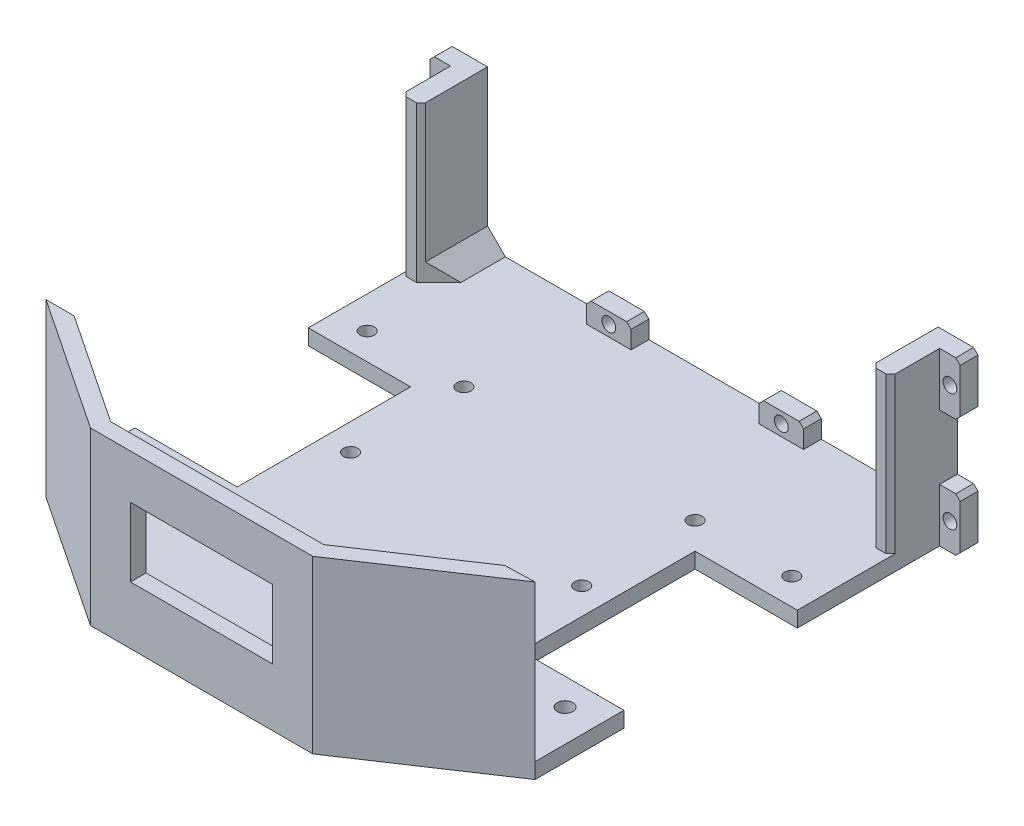
from build123d import *

# Parameters (mm, degrees)
BOSS_EXTRUDE1_DEPTH  = 3.5
BOSS_EXTRUDE2_DEPTH  = 21
SKETCH3_W            = 23
SKETCH3_H            = 39
BOSS_EXTRUDE3_DEPTH  = 2.5
SKETCH5_W            = 21.5
SKETCH5_H            = 25
SKETCH5_W_2          = 7.07
SKETCH5_H_2          = 19.04
BOSS_EXTRUDE5_DEPTH  = 2.5
SKETCH6_W            = 7.07
SKETCH6_H            = 5.9
BOSS_EXTRUDE6_DEPTH  = 20
BOSS_EXTRUDE7_DEPTH  = 23
FILLET1_SIZE         = 10
SKETCH9_R            = 2.475
BOSS_EXTRUDE8_DEPTH  = 9
FILLET2_R            = 0.5
SKETCH10_R           = 1.65
CUT_EXTRUDE1_DEPTH   = 9
SKETCH11_W           = 0.2
SKETCH11_H           = 20
CUT_EXTRUDE2_DEPTH   = 9
CUT_EXTRUDE3_DEPTH   = 9
FILLET3_SIZE         = 3
BOSS_EXTRUDE9_DEPTH  = 5
SKETCH14_R           = 1.747814763
SKETCH14_R_2         = 1.6
CUT_EXTRUDE4_DEPTH   = 15
BOSS_EXTRUDE10_DEPTH = 35
SKETCH17_W           = 110
SKETCH17_H           = 3.5
BOSS_EXTRUDE11_DEPTH = 15
SKETCH18_W           = 161.485932181
SKETCH18_H           = 44
CUT_EXTRUDE5_DEPTH   = 63
SKETCH19_W           = 4.328620931
SKETCH19_H           = 15
BOSS_EXTRUDE12_DEPTH = 35
FILLET4_SIZE         = 1
SKETCH20_W           = 4.640065176
SKETCH20_H           = 12
SKETCH20_R           = 1.55
SKETCH20_W_2         = 10
SKETCH20_H_2         = 5
BOSS_EXTRUDE13_DEPTH = 4
SKETCH21_W           = 32
SKETCH21_H           = 15.5
CUT_EXTRUDE6_DEPTH   = 14
FILLET5_SIZE         = 1
FILLET6_SIZE         = 4


with BuildPart() as part:
    # Sketch1 → Boss-Extrude1 (new body)
    with BuildSketch(Plane(origin=(0, 0, 0), x_dir=(1, 0, 0), z_dir=(0, 1, 0))):
        Polygon((0, 40), (23, 40), (23, 79), (0, 79), (0, 100), (110, 100), (110, 79), (87, 79), (87, 40), (110, 40), (110, 20), (80, 0), (30, 0), (0, 20), align=None)
    extrude(amount=BOSS_EXTRUDE1_DEPTH)

    # Sketch2 → Boss-Extrude2 (add)
    with BuildSketch(Plane(origin=(0, 3.5, 0), x_dir=(1, 0, 0), z_dir=(0, 1, 0))):
        Polygon((0, 79), (23, 79), (23, 40), (0, 40), (0, 37.5), (25.5, 37.5), (25.5, 81.5), (0, 81.5), align=None)
        Polygon((110, 81.5), (84.5, 81.5), (84.5, 37.5), (110, 37.5), (110, 40), (87, 40), (87, 79), (110, 79), align=None)
    extrude(amount=BOSS_EXTRUDE2_DEPTH)

    # Sketch3 → Boss-Extrude3 (add)
    with BuildSketch(Plane(origin=(0, 24.5, 0), x_dir=(1, 0, 0), z_dir=(0, 1, 0))):
        with Locations((11.5, 59.5)):
            Rectangle(SKETCH3_W, SKETCH3_H)
        with Locations((98.5, 59.5)):
            Rectangle(SKETCH3_W, SKETCH3_H)
    extrude(amount=-BOSS_EXTRUDE3_DEPTH)

    # Sketch5 → Boss-Extrude5 (add)
    with BuildSketch(Plane(origin=(0, 24.5, 0), x_dir=(1, 0, 0), z_dir=(0, 1, 0))):
        with Locations((120.75, 50)):
            Rectangle(SKETCH5_W, SKETCH5_H)
        with Locations((-10.75, 50)):
            Rectangle(SKETCH5_W, SKETCH5_H)
        with Locations((29.035, 47.02)):
            Rectangle(SKETCH5_W_2, SKETCH5_H_2)
        with Locations((80.965, 47.02)):
            Rectangle(SKETCH5_W_2, SKETCH5_H_2)
    extrude(amount=-BOSS_EXTRUDE5_DEPTH)

    # Sketch6 → Boss-Extrude6 (add)
    with BuildSketch(Plane(origin=(0, 24.5, 0), x_dir=(1, 0, 0), z_dir=(0, 1, 0))):
        with Locations((29.035, 53.59)):
            Rectangle(SKETCH6_W, SKETCH6_H)
        with Locations((80.965, 53.59)):
            Rectangle(SKETCH6_W, SKETCH6_H)
        with Locations((-17.965, 53.59)):
            Rectangle(SKETCH6_W, SKETCH6_H)
        with Locations((127.965, 53.59)):
            Rectangle(SKETCH6_W, SKETCH6_H)
    extrude(amount=BOSS_EXTRUDE6_DEPTH)

    # Sketch7 → Boss-Extrude7 (add)
    with BuildSketch(Plane(origin=(0, 24.5, 0), x_dir=(1, 0, 0), z_dir=(0, 1, 0))):
        Polygon((0, 81.5), (25.5, 81.5), (25.5, 79), (0, 79), (-21.5, 79), (-21.5, 81.5), align=None)
        Polygon((110, 79), (84.5, 79), (84.5, 81.5), (110, 81.5), (131.5, 81.5), (131.5, 79), align=None)
    extrude(amount=BOSS_EXTRUDE7_DEPTH)

    # Fillet1
    # the kernel refuses this chamfer: 10 mm, written as the material it adds along each edge
    with BuildSketch(Plane(origin=(0, 22, -40), x_dir=(0.027495876610586372, -0.9996219169112968, 0), z_dir=(0, 0, 1)), Plane(origin=(110, 22, -37.5), x_dir=(-0.027495876610586317, -0.9996219169112968, 0), z_dir=(0, 0, -1)), Plane(origin=(110, 24.5, -81.5), x_dir=(0.9996219169112968, 0.027495876610586317, 0), z_dir=(0, 0, 1))) as fillet1_piece_1:
        Polygon((FILLET1_SIZE * 0.999621916911, -FILLET1_SIZE * 0.0274958766106), (-FILLET1_SIZE * 0.0274958766106, -FILLET1_SIZE * 0.999621916911), (0, 0), align=None)
    extrude(amount=2.5)
    with BuildSketch(Plane(origin=(0, 24.5, -79), x_dir=(0.027495876610586372, -0.9996219169112968, 0), z_dir=(0, 0, -1))) as fillet1_piece_2:
        Polygon((FILLET1_SIZE * 0.999621916911, FILLET1_SIZE * 0.0274958766106), (-FILLET1_SIZE * 0.0274958766106, FILLET1_SIZE * 0.999621916911), (0, 0), align=None)
    extrude(amount=2.5)

    # Sketch9 → Boss-Extrude8 (add)
    with BuildSketch(Plane(origin=(0, 0, -81.5), x_dir=(-1, 0, 0), z_dir=(0, 0, -1))):
        with Locations(Location((-114.55, 34.35, 0), (0, 0, 180))):
            Circle(SKETCH9_R)
        with Locations(Location((4.55, 34.35, 0), (0, 0, 180))):
            Circle(SKETCH9_R)
    extrude(amount=BOSS_EXTRUDE8_DEPTH)

    # Fillet2
    fillet2_edges = [part.edges().sort_by_distance(p)[0] for p in [
        (112.075, 34.35, -90.5),
        (-7.025, 34.35, -90.5),
    ]]
    fillet(fillet2_edges, radius=FILLET2_R)

    # Sketch10 → Cut-Extrude1 (cut)
    with BuildSketch(Plane.XY.offset(-50.64)):
        with Locations((129.16, 39.27)):
            Circle(SKETCH10_R)
        with Locations((129.16, 29.43)):
            Circle(SKETCH10_R)
        with Locations((79.77, 39.27)):
            Circle(SKETCH10_R)
        with Locations((79.77, 29.43)):
            Circle(SKETCH10_R)
        with Locations((-19.16, 29.43)):
            Circle(SKETCH10_R)
        with Locations((-19.16, 39.27)):
            Circle(SKETCH10_R)
        with Locations(Location((30.23, 39.27, 0), (0, 0, 180))):
            Circle(SKETCH10_R)
        with Locations(Location((30.23, 29.43, 0), (0, 0, 180))):
            Circle(SKETCH10_R)
    extrude(amount=-CUT_EXTRUDE1_DEPTH, mode=Mode.SUBTRACT)

    # Sketch11 → Cut-Extrude2 (cut)
    with BuildSketch(Plane.XY.offset(-50.64)):
        with Locations((-14.53, 34.5)):
            Rectangle(SKETCH11_W, SKETCH11_H)
        with Locations((25.6, 34.5)):
            Rectangle(SKETCH11_W, SKETCH11_H)
        with Locations((84.4, 34.5)):
            Rectangle(SKETCH11_W, SKETCH11_H)
        with Locations((124.53, 34.5)):
            Rectangle(SKETCH11_W, SKETCH11_H)
    extrude(amount=-CUT_EXTRUDE2_DEPTH, mode=Mode.SUBTRACT)

    # Sketch12 → Cut-Extrude3 (cut)
    with BuildSketch(Plane(origin=(0, 0, -81.5), x_dir=(-1, 0, 0), z_dir=(0, 0, -1))):
        Polygon((-108, 47.5), (-84.5, 25.5), (-84.5, 47.5), align=None)
        Polygon((-25.5, 25.5), (-25.5, 47.5), (-2, 47.5), align=None)
        Polygon((-120, 24.5), (-131.5, 36), (-131.5, 24.5), align=None)
        Polygon((10, 24.5), (21.5, 36), (21.5, 24.5), align=None)
    extrude(amount=-CUT_EXTRUDE3_DEPTH, mode=Mode.SUBTRACT)

    # Fillet3
    fillet3_edges = [part.edges().sort_by_distance(p)[0] for p in [
        (0, 23.25, -62.5),
        (110, 23.25, -62.5),
    ]]
    chamfer(fillet3_edges, length=FILLET3_SIZE)

    # Sketch13 → Boss-Extrude9 (add)
    with BuildSketch(Plane(origin=(0, 3.5, 0), x_dir=(1, 0, 0), z_dir=(0, 1, 0))):
        Polygon((0, 30.5), (32.5, 30.5), (32.5, 88.5), (0, 88.5), (0, 81.5), (25.5, 81.5), (25.5, 37.5), (0, 37.5), align=None)
        Polygon((84.5, 37.5), (110, 37.5), (110, 30.5), (77.5, 30.5), (77.5, 88.5), (110, 88.5), (110, 81.5), (84.5, 81.5), align=None)
    extrude(amount=BOSS_EXTRUDE9_DEPTH)

    # Sketch14 → Cut-Extrude4 (cut)
    with BuildSketch(Plane(origin=(0, 8.5, 0), x_dir=(1, 0, 0), z_dir=(0, 1, 0))):
        with Locations(Location((7.25, 34, 0), (0, 0, 270))):
            Circle(SKETCH14_R)
        with Locations(Location((7.25, 85, 0), (0, 0, 270))):
            Circle(SKETCH14_R_2)
        with Locations(Location((29, 34, 0), (0, 0, 270))):
            Circle(SKETCH14_R_2)
        with Locations(Location((29, 59.5, 0), (0, 0, 270))):
            Circle(SKETCH14_R_2)
        with Locations(Location((29, 85, 0), (0, 0, 270))):
            Circle(SKETCH14_R_2)
        with Locations(Location((81, 34, 0), (0, 0, 90))):
            Circle(SKETCH14_R_2)
        with Locations(Location((102.75, 34, 0), (0, 0, 90))):
            Circle(SKETCH14_R)
        with Locations(Location((81, 59.5, 0), (0, 0, 90))):
            Circle(SKETCH14_R_2)
        with Locations(Location((81, 85, 0), (0, 0, 90))):
            Circle(SKETCH14_R_2)
        with Locations(Location((102.75, 85, 0), (0, 0, 90))):
            Circle(SKETCH14_R_2)
    extrude(amount=-CUT_EXTRUDE4_DEPTH, mode=Mode.SUBTRACT)

    # Sketch15 → Boss-Extrude10 (add)
    with BuildSketch(Plane(origin=(0, 3.5, 0), x_dir=(1, 0, 0), z_dir=(0, 1, 0))):
        Polygon((110, 20), (80, 0), (30, 0), (0, 20), (6.309714732, 20), (31.059714732, 3.5), (78.940285268, 3.5), (103.405491726, 19.81009599), align=None)
    extrude(amount=BOSS_EXTRUDE10_DEPTH)

    # Sketch17 → Boss-Extrude11 (add)
    with BuildSketch(Plane(origin=(0, 0, -100), x_dir=(-1, 0, 0), z_dir=(0, 0, -1))):
        with Locations((-55, 1.75)):
            Rectangle(SKETCH17_W, SKETCH17_H)
    extrude(amount=BOSS_EXTRUDE11_DEPTH)

    # Sketch18 → Cut-Extrude5 (cut)
    with BuildSketch(Plane(origin=(0, 0, -88.5), x_dir=(-1, 0, 0), z_dir=(0, 0, -1))):
        with Locations((-59.242966091, 25.5)):
            Rectangle(SKETCH18_W, SKETCH18_H)
    extrude(amount=-CUT_EXTRUDE5_DEPTH, mode=Mode.SUBTRACT)


with BuildPart() as body_2:
    # of the pieces the cut leaves, the one that is kept (cut_extrude5_keep)
    add(part.part.solids().sort_by_distance((0, 3.5, -79))[0])

    # Sketch19 → Boss-Extrude12 (add)
    with BuildSketch(Plane(origin=(0, 3.5, 0), x_dir=(1, 0, 0), z_dir=(0, 1, 0))):
        with Locations((107.835689535, 107.5)):
            Rectangle(SKETCH19_W, SKETCH19_H)
        with Locations((2.164310466, 107.5)):
            Rectangle(SKETCH19_W, SKETCH19_H)
    extrude(amount=BOSS_EXTRUDE12_DEPTH)

    # Fillet4
    fillet4_edges = [body_2.edges().sort_by_distance(p)[0] for p in [
        (0, 21, -100),
        (4.328620931, 21, -100),
        (110, 21, -100),
        (105.671379069, 21, -100),
    ]]
    chamfer(fillet4_edges, length=FILLET4_SIZE)

    # Sketch20 → Boss-Extrude13 (add)
    # profile 1 of 6: a face of its own
    with BuildSketch(Plane(origin=(0, 0, -115), x_dir=(-1, 0, 0), z_dir=(0, 0, -1))):
        with Locations((-112.320032588, 32.5)):
            Rectangle(SKETCH20_W, SKETCH20_H)
        with Locations((-112.320032588, 32.5)):
            Circle(SKETCH20_R, mode=Mode.SUBTRACT)
    # profile 2 of 6: a face of its own
    with BuildSketch(Plane(origin=(0, 0, -115), x_dir=(-1, 0, 0), z_dir=(0, 0, -1))):
        with Locations((-112.320032588, 6)):
            Rectangle(SKETCH20_W, SKETCH20_H)
        with Locations((-112.320032588, 6)):
            Circle(SKETCH20_R, mode=Mode.SUBTRACT)
    # profile 3 of 6: a face of its own
    with BuildSketch(Plane(origin=(0, 0, -115), x_dir=(-1, 0, 0), z_dir=(0, 0, -1))):
        with Locations((2.320032588, 6)):
            Rectangle(SKETCH20_W, SKETCH20_H)
        with Locations(Location((2.320032588, 6, 0), (0, 0, 180))):
            Circle(SKETCH20_R, mode=Mode.SUBTRACT)
    # profile 4 of 6: a face of its own
    with BuildSketch(Plane(origin=(0, 0, -115), x_dir=(-1, 0, 0), z_dir=(0, 0, -1))):
        with Locations((2.320032588, 32.5)):
            Rectangle(SKETCH20_W, SKETCH20_H)
        with Locations(Location((2.320032588, 32.5, 0), (0, 0, 180))):
            Circle(SKETCH20_R, mode=Mode.SUBTRACT)
    # profile 5 of 6: a face of its own
    with BuildSketch(Plane(origin=(0, 0, -115), x_dir=(-1, 0, 0), z_dir=(0, 0, -1))):
        with Locations((-74.4, 6)):
            Rectangle(SKETCH20_W_2, SKETCH20_H_2)
        with Locations((-74.4, 6)):
            Circle(SKETCH20_R, mode=Mode.SUBTRACT)
    # profile 6 of 6: a face of its own
    with BuildSketch(Plane(origin=(0, 0, -115), x_dir=(-1, 0, 0), z_dir=(0, 0, -1))):
        with Locations((-35.6, 6)):
            Rectangle(SKETCH20_W_2, SKETCH20_H_2)
        with Locations(Location((-35.6, 6, 0), (0, 0, 180))):
            Circle(SKETCH20_R, mode=Mode.SUBTRACT)
    extrude(amount=-BOSS_EXTRUDE13_DEPTH)

    # Sketch21 → Cut-Extrude6 (cut)
    with BuildSketch(Plane.XY):
        with Locations((55, 20.75)):
            Rectangle(SKETCH21_W, SKETCH21_H)
    extrude(amount=-CUT_EXTRUDE6_DEPTH, mode=Mode.SUBTRACT)

    # Fillet5
    fillet5_edges = [body_2.edges().sort_by_distance(p)[0] for p in [
        (114.640065176, 26.5, -113),
        (114.640065176, 38.5, -113),
        (114.640065176, 0, -113),
        (114.640065176, 12, -113),
        (-4.640065176, 12, -113),
        (-4.640065176, 0, -113),
        (-4.640065176, 38.5, -113),
        (-4.640065176, 26.5, -113),
        (79.4, 8.5, -113),
        (69.4, 8.5, -113),
        (30.6, 8.5, -113),
        (40.6, 8.5, -113),
    ]]
    chamfer(fillet5_edges, length=FILLET5_SIZE)

    # Fillet6
    fillet6_edges = [body_2.edges().sort_by_distance(p)[0] for p in [
        (105.671379069, 3.5, -108),
        (4.328620931, 3.5, -108),
    ]]
    chamfer(fillet6_edges, length=FILLET6_SIZE)


solid = body_2.part
